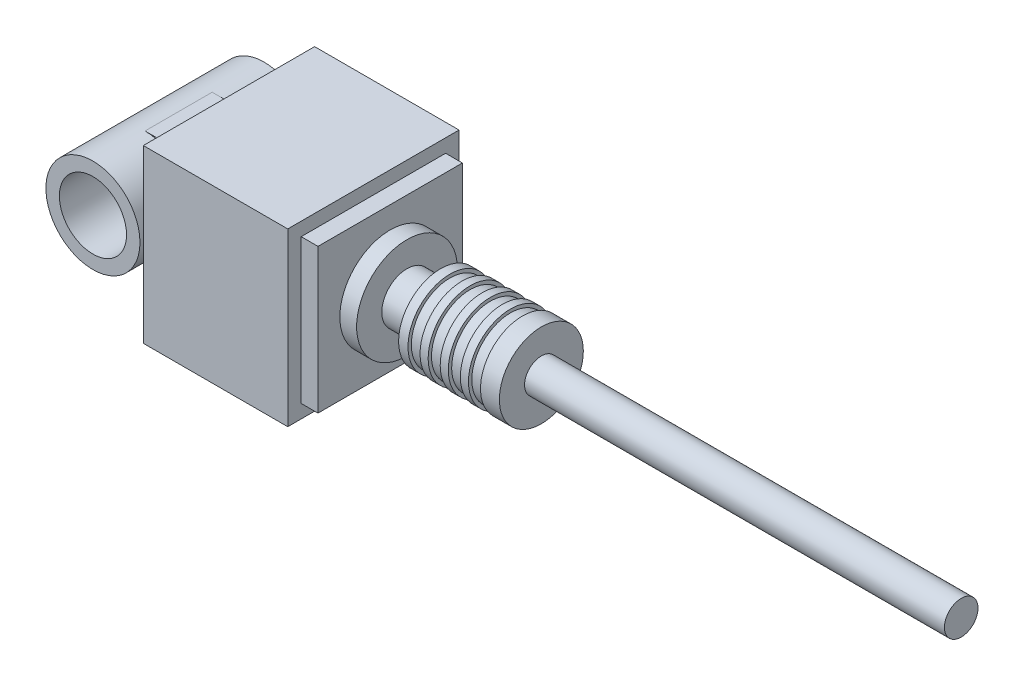
from build123d import *

# Parameters (mm, degrees)
SKETCH2_R               = 14
SKETCH2_R_2             = 10
EXTRUDE1_DEPTH          = 25.5
EXTRUDE2_DEPTH          = 10
SKETCH4_W               = 51
SKETCH4_H               = 51
EXTRUDE3_DEPTH          = 3
SKETCH5_W               = 51
SKETCH5_H               = 51
SKETCH5_W_2             = 43
SKETCH5_H_2             = 43
EXTRUDE4_DEPTH          = 40
SKETCH8_W               = 25
SKETCH8_H               = 20
EXTRUDE8_DEPTH          = 40
SKETCH10_W              = 43
SKETCH10_H              = 43
EXTRUDE10_DEPTH         = 45
SKETCH11_R              = 15
EXTRUDE11_DEPTH         = 5
SKETCH12_W              = 5
SKETCH12_H              = 25
EXTRUDE12_DEPTH         = 5
SKETCH13_R              = 1.5
EXTRUDE13_DEPTH         = 5
SKETCH14_R              = 7.5
EXTRUDE14_DEPTH         = 10
SKETCH15_R              = 12.5
EXTRUDE15_DEPTH         = 30
SKETCH16_R              = 5
EXTRUDE16_DEPTH         = 125
EXTRUDE17_START         = 80.797218397
EXTRUDE17_OUTLINE_R     = 12.5
EXTRUDE17_OUTLINE_R_2   = 11.5
EXTRUDE17_DEPTH         = 3.587847701
EXTRUDE17_START_2       = 86.797218397
EXTRUDE17_2_OUTLINE_R   = 12.5
EXTRUDE17_2_OUTLINE_R_2 = 11.5
EXTRUDE17_2_DEPTH       = 3.587847701
EXTRUDE17_START_3       = 92.797218397
EXTRUDE17_3_OUTLINE_R   = 12.5
EXTRUDE17_3_OUTLINE_R_2 = 11.5
EXTRUDE17_3_DEPTH       = 3.587847701
EXTRUDE17_START_4       = 98.797218397
EXTRUDE17_4_OUTLINE_R   = 12.5
EXTRUDE17_4_OUTLINE_R_2 = 11.5
EXTRUDE17_4_DEPTH       = 3.587847701


# Read off the part's stored shape, not the designer's step: Extrude17
with BuildPart() as part:
    # Sketch2 → Extrude1 (new, symmetric)
    with BuildSketch(Plane.XY):
        Circle(SKETCH2_R)
        Circle(SKETCH2_R_2, mode=Mode.SUBTRACT)
    extrude(amount=EXTRUDE1_DEPTH, both=True)

    # Sketch3 → Extrude2 (add, symmetric)
    with BuildSketch(Plane.XY):
        with BuildLine():
            Line((0, 14), (15, 14))
            Line((15, 14), (15, -14))
            Line((15, -14), (0, -14))
            ThreePointArc((0, -14), (14, 0), (0, 14))
        make_face()
    extrude(amount=EXTRUDE2_DEPTH, both=True)

    # Sketch4 → Extrude3 (add)
    with BuildSketch(Plane(origin=(15, 0, 0), x_dir=(0, 0, -1), z_dir=(1, 0, 0))):
        Rectangle(SKETCH4_W, SKETCH4_H)
    extrude(amount=EXTRUDE3_DEPTH)

    # Sketch5 → Extrude4 (add)
    with BuildSketch(Plane(origin=(18, 0, 0), x_dir=(0, 0, -1), z_dir=(1, 0, 0))):
        Rectangle(SKETCH5_W, SKETCH5_H)
        Rectangle(SKETCH5_W_2, SKETCH5_H_2, mode=Mode.SUBTRACT)
    extrude(amount=EXTRUDE4_DEPTH)

    # Sketch8 → Extrude8 (cut)
    with BuildSketch(Plane(origin=(58, 0, 0), x_dir=(0, 0, -1), z_dir=(1, 0, 0))):
        with Locations((0, -25.5)):
            Rectangle(SKETCH8_W, SKETCH8_H)
    extrude(amount=-EXTRUDE8_DEPTH, mode=Mode.SUBTRACT)

    # Sketch10 → Extrude10 (add)
    with BuildSketch(Plane(origin=(18, 0, 0), x_dir=(0, 0, -1), z_dir=(1, 0, 0))):
        Rectangle(SKETCH10_W, SKETCH10_H)
    extrude(amount=EXTRUDE10_DEPTH)

    # Sketch11 → Extrude11 (add)
    with BuildSketch(Plane(origin=(63, 0, 0), x_dir=(0, 0, -1), z_dir=(1, 0, 0))):
        Circle(SKETCH11_R)
    extrude(amount=EXTRUDE11_DEPTH)

    # Sketch12 → Extrude12 (add)
    with BuildSketch(Plane.XZ.offset(21.5)):
        with Locations((20.5, 0)):
            Rectangle(SKETCH12_W, SKETCH12_H)
    extrude(amount=EXTRUDE12_DEPTH)

    # Sketch13 → Extrude13 (add)
    with BuildSketch(Plane.XZ.offset(26.5)):
        with Locations(Location((20.514171065, 8.5, 0), (0, 0, 270))):
            Circle(SKETCH13_R)
        with Locations(Location((20.514171065, 3.5, 0), (0, 0, 270))):
            Circle(SKETCH13_R)
        with Locations(Location((20.514171065, -3.5, 0), (0, 0, 270))):
            Circle(SKETCH13_R)
        with Locations(Location((20.514171065, -8.5, 0), (0, 0, 270))):
            Circle(SKETCH13_R)
    extrude(amount=EXTRUDE13_DEPTH)

    # Sketch14 → Extrude14 (add)
    with BuildSketch(Plane(origin=(68, 0, 0), x_dir=(0, 0, -1), z_dir=(1, 0, 0))):
        Circle(SKETCH14_R)
    extrude(amount=EXTRUDE14_DEPTH)

    # Sketch15 → Extrude15 (add)
    with BuildSketch(Plane(origin=(78, 0, 0), x_dir=(0, 0, -1), z_dir=(1, 0, 0))):
        Circle(SKETCH15_R)
    extrude(amount=EXTRUDE15_DEPTH)

    # Sketch16 → Extrude16 (add)
    with BuildSketch(Plane(origin=(108, 0, 0), x_dir=(0, 0, -1), z_dir=(1, 0, 0))):
        Circle(SKETCH16_R)
    extrude(amount=EXTRUDE16_DEPTH)

    # Extrude17 outline → Extrude17 (cut)
    with BuildSketch(Plane.YZ.offset(EXTRUDE17_START)):
        Circle(EXTRUDE17_OUTLINE_R)
        Circle(EXTRUDE17_OUTLINE_R_2, mode=Mode.SUBTRACT)
    extrude(amount=EXTRUDE17_DEPTH, mode=Mode.SUBTRACT)

    # Extrude17 2 outline → Extrude17 2 (cut)
    with BuildSketch(Plane.YZ.offset(EXTRUDE17_START_2)):
        Circle(EXTRUDE17_2_OUTLINE_R)
        Circle(EXTRUDE17_2_OUTLINE_R_2, mode=Mode.SUBTRACT)
    extrude(amount=EXTRUDE17_2_DEPTH, mode=Mode.SUBTRACT)

    # Extrude17 3 outline → Extrude17 3 (cut)
    with BuildSketch(Plane.YZ.offset(EXTRUDE17_START_3)):
        Circle(EXTRUDE17_3_OUTLINE_R)
        Circle(EXTRUDE17_3_OUTLINE_R_2, mode=Mode.SUBTRACT)
    extrude(amount=EXTRUDE17_3_DEPTH, mode=Mode.SUBTRACT)

    # Extrude17 4 outline → Extrude17 4 (cut)
    with BuildSketch(Plane.YZ.offset(EXTRUDE17_START_4)):
        Circle(EXTRUDE17_4_OUTLINE_R)
        Circle(EXTRUDE17_4_OUTLINE_R_2, mode=Mode.SUBTRACT)
    extrude(amount=EXTRUDE17_4_DEPTH, mode=Mode.SUBTRACT)


solid = part.part
